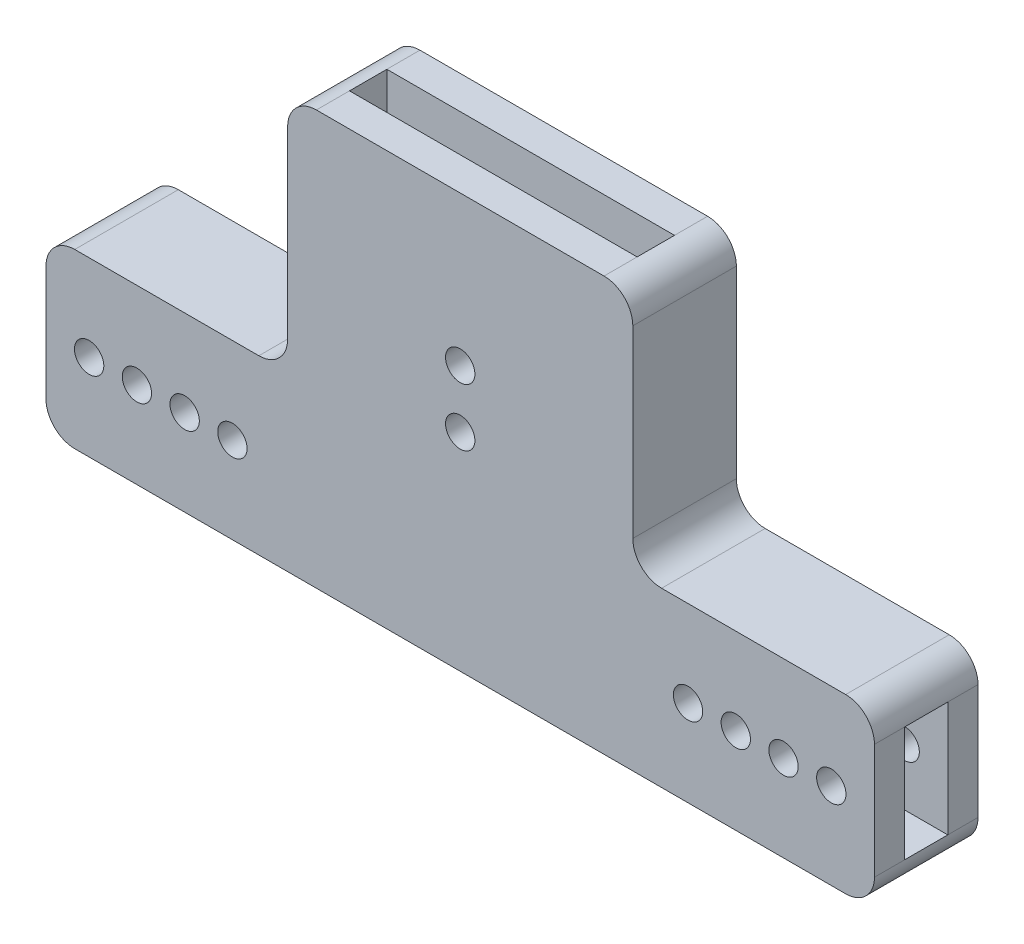
from build123d import *

# Parameters (mm, degrees)
SKETCH1_W           = 60
SKETCH1_H           = 72
BOSS_EXTRUDE1_DEPTH = 18
SKETCH2_W           = 50
SKETCH2_H           = 6.5
CUT_EXTRUDE1_DEPTH  = 81.049984385
SKETCH3_W           = 18
SKETCH3_H           = 30
BOSS_EXTRUDE2_DEPTH = 42
SKETCH4_W           = 7.5
SKETCH4_H           = 20
CUT_EXTRUDE2_DEPTH  = 42.5
SKETCH5_R           = 2.55
CUT_EXTRUDE3_DEPTH  = 35
FILLET1_R           = 5
SKETCH6_R           = 2.55
CUT_EXTRUDE4_DEPTH  = 35


with BuildPart() as part:
    # Sketch1 → Boss-Extrude1 (new body)
    with BuildSketch(Plane.XY):
        Rectangle(SKETCH1_W, SKETCH1_H)
    extrude(amount=BOSS_EXTRUDE1_DEPTH)

    # Sketch2 → Cut-Extrude1 (cut, through all)
    with BuildSketch(Plane(origin=(0, 36, 0), x_dir=(1, 0, 0), z_dir=(0, 1, 0))):
        with Locations((0, -9)):
            Rectangle(SKETCH2_W, SKETCH2_H)
    extrude(amount=-CUT_EXTRUDE1_DEPTH, mode=Mode.SUBTRACT)

    # Sketch3 → Boss-Extrude2 (add)
    with BuildSketch(Plane.ZY.offset(30)):
        with Locations((9, -21)):
            Rectangle(SKETCH3_W, SKETCH3_H)
    boss_extrude2 = extrude(amount=BOSS_EXTRUDE2_DEPTH)

    # Sketch4 → Cut-Extrude2 (cut)
    with BuildSketch(Plane.ZY.offset(72)):
        with Locations((9, -21)):
            Rectangle(SKETCH4_W, SKETCH4_H)
    cut_extrude2 = extrude(amount=-CUT_EXTRUDE2_DEPTH, mode=Mode.SUBTRACT)

    # Sketch5 → Cut-Extrude3 (cut)
    with BuildSketch(Plane.XY.offset(18)):
        with Locations((-64.5, -21)):
            Circle(SKETCH5_R)
        with Locations((-56.2, -21)):
            Circle(SKETCH5_R)
        with Locations((-47.9, -21)):
            Circle(SKETCH5_R)
        with Locations((-39.6, -21)):
            Circle(SKETCH5_R)
    cut_extrude3 = extrude(amount=-CUT_EXTRUDE3_DEPTH, mode=Mode.SUBTRACT)

    # Mirror1: Boss-Extrude2, Cut-Extrude2, Cut-Extrude3 across plane
    add(boss_extrude2.mirror(Plane(origin=(0, 0, 0), x_dir=(0, 0, 1), z_dir=(1, 0, 0))))
    add(cut_extrude2.mirror(Plane(origin=(0, 0, 0), x_dir=(0, 0, 1), z_dir=(1, 0, 0))), mode=Mode.SUBTRACT)
    add(cut_extrude3.mirror(Plane(origin=(0, 0, 0), x_dir=(0, 0, 1), z_dir=(1, 0, 0))), mode=Mode.SUBTRACT)

    # Fillet1
    fillet1_edges = [part.edges().sort_by_distance(p)[0] for p in [
        (-30, -6, 9),
        (-72, -36, 9),
        (-72, -6, 9),
        (-30, 36, 9),
        (30, 36, 9),
        (72, -6, 9),
        (72, -36, 9),
        (30, -6, 9),
    ]]
    fillet(fillet1_edges, radius=FILLET1_R - 0.0001)  # a hair under: the kernel refuses the full size

    # Sketch6 → Cut-Extrude4 (cut)
    with BuildSketch(Plane.XY.offset(18)):
        Circle(SKETCH6_R)
        with Locations((0, 10)):
            Circle(SKETCH6_R)
    extrude(amount=-CUT_EXTRUDE4_DEPTH, mode=Mode.SUBTRACT)


solid = part.part
